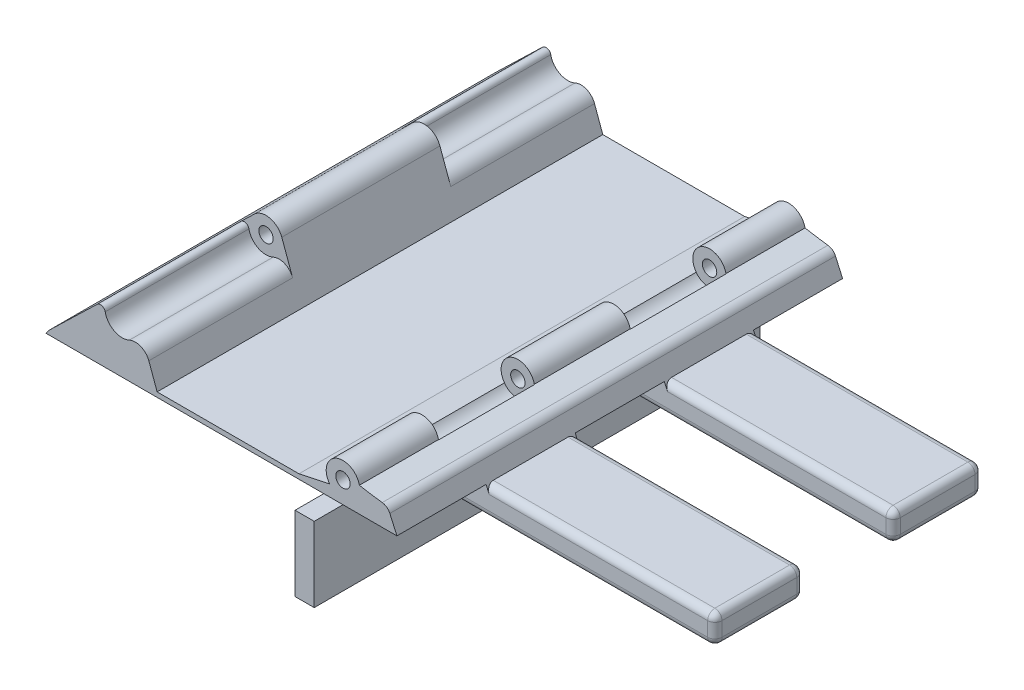
from build123d import *

# Parameters (mm, degrees)
SALIENTE_EXTRUIR2_DEPTH   = 46.49999999999997
CROQUIS3_R                = 1.5007742960379549
CROQUIS3_R_2              = 1.503322104684281
CORTAR_EXTRUIR1_DEPTH     = 46.49999999999997
CORTAR_EXTRUIR2_START     = 16.5
CORTAR_EXTRUIR2_OUTLINE_R = 1.500774296
CORTAR_EXTRUIR2_DEPTH     = 30
REDONDEO2_R               = 3
CORTAR_EXTRUIR3_START     = -46.5
CORTAR_EXTRUIR3_OUTLINE_R = 1.500774296
CORTAR_EXTRUIR3_DEPTH     = 30
REDONDEO3_R               = 3
CORTAR_EXTRUIR4_START     = 10
CORTAR_EXTRUIR4_OUTLINE_R = 1.503322105
CORTAR_EXTRUIR4_DEPTH     = 20
CORTAR_EXTRUIR5_START     = -30
CORTAR_EXTRUIR5_OUTLINE_R = 1.503322105
CORTAR_EXTRUIR5_DEPTH     = 20
REDONDEO4_R               = 1
CORTAR_EXTRUIR12_DEPTH    = 155.46083657878992
CROQUIS6_W                = 18.599999999999966
CROQUIS6_H                = 6.000000000000004
CORTAR_EXTRUIR13_DEPTH    = 133.823646460648
CROQUIS7_W                = 18.599999999999966
CROQUIS7_H                = 6.000000000000004
CORTAR_EXTRUIR14_DEPTH    = 133.823646460648
REDONDEO5_R               = 1.5
REDONDEO6_R               = 2


# Read off the part's stored shape, not the designer's step: Cortar-Extruir2, Cortar-Extruir3, Cortar-Extruir4, Cortar-Extruir5
with BuildPart() as part:
    # Croquis1 → Saliente-Extruir2 (new, symmetric)
    with BuildSketch(Plane.XY):
        with BuildLine():
            Line((-10.683677010448408, -0.13792021644576552), (-8.74048031278475, -4.500000000012256))
            Line((-8.74048031278475, -4.500000000012256), (39.00000000000001, -4.500000000012256))
            Line((39.00000000000001, -4.500000000012256), (39.00000000000001, -10.500000000012262))
            Line((39.00000000000001, -10.500000000012262), (-25.99999999999999, -10.500000000012262))
            Line((-25.99999999999999, -10.500000000012262), (-25.99999999999999, -26.10000000001226))
            Line((-25.99999999999999, -26.10000000001226), (-29.999999999999986, -26.100000000012262))
            Line((-29.999999999999986, -26.100000000012262), (-29.999999999999993, -10.500000000012264))
            Line((-29.999999999999993, -10.500000000012264), (-81.19999999999999, -10.500000000012271))
            ThreePointArc((-81.19999999999999, -10.500000000012271), (-82.6497474683058, -7.000000000012269), (-81.19999999999999, -3.5000000000122697))
            Line((-81.19999999999999, -3.5000000000122697), (-68.49110633124283, 8.777732226211745))
            ThreePointArc((-68.49110633124283, 8.777732226211745), (-65.27231144406849, 9.67090124633749), (-62.77037609438549, 7.457598074555828))
            Line((-62.77037609438549, 7.457598074555828), (-58.782136556190004, -3.5000000000122684))
            Line((-58.782136556190004, -3.5000000000122684), (-29.179236040573016, -3.500000000012267))
            Line((-29.179236040573016, -3.500000000012267), (-22.77115447929422, -2.1379202164457745))
            ThreePointArc((-22.77115447929422, -2.1379202164457745), (-21.470497358111732, 3.17610414183578), (-16.57695737694327, 0.729917256089285))
            ThreePointArc((-16.57695737694327, 0.729917256089285), (-13.63855195060632, 0.24007822050397465), (-10.683677010448408, -0.13792021644576552))
        make_face()
    extrude(amount=SALIENTE_EXTRUIR2_DEPTH, both=True)

    # Croquis3 → Cortar-Extruir1 (cut, symmetric)
    with BuildSketch(Plane.XY):
        with Locations((-66.05930026713617, 6.260527572915973)):
            Circle(CROQUIS3_R)
        with Locations((-19.999999999999996, 0)):
            Circle(CROQUIS3_R_2)
    extrude(amount=CORTAR_EXTRUIR1_DEPTH, both=True, mode=Mode.SUBTRACT)

    # Cortar-Extruir2 outline → Cortar-Extruir2 (cut)
    with BuildSketch(Plane.XY.offset(CORTAR_EXTRUIR2_START)):
        with BuildLine():
            Line((-68.491106331, 8.777732226), (-69.201699105, 8.091246996))
            ThreePointArc((-69.201699105, 8.091246996), (-66.848168988, 2.721235528), (-62.462991688, 6.61306636))
            Line((-62.462991688, 6.61306636), (-62.770376094, 7.457598075))
            ThreePointArc((-62.770376094, 7.457598075), (-65.272311444, 9.670901246), (-68.491106331, 8.777732226))
        make_face()
        with Locations((-66.059300267, 6.260527573)):
            Circle(CORTAR_EXTRUIR2_OUTLINE_R, mode=Mode.SUBTRACT)
    extrude(amount=CORTAR_EXTRUIR2_DEPTH, mode=Mode.SUBTRACT)

    # Redondeo2
    redondeo2_edges = [part.edges().sort_by_distance(p)[0] for p in [
        (-62.462991687999995, 6.613066360000001, 31.5),
    ]]
    fillet(redondeo2_edges, radius=REDONDEO2_R)

    # Cortar-Extruir3 outline → Cortar-Extruir3 (cut)
    with BuildSketch(Plane.XY.offset(CORTAR_EXTRUIR3_START)):
        with BuildLine():
            ThreePointArc((-69.164573514, 8.127113066), (-66.827048097, 2.685630168), (-62.508602445, 6.738380883))
            Line((-62.508602445, 6.738380883), (-62.770376094, 7.457598075))
            ThreePointArc((-62.770376094, 7.457598075), (-65.272311444, 9.670901246), (-68.491106331, 8.777732226))
            Line((-68.491106331, 8.777732226), (-69.164573514, 8.127113066))
        make_face()
        with Locations((-66.059300267, 6.260527573)):
            Circle(CORTAR_EXTRUIR3_OUTLINE_R, mode=Mode.SUBTRACT)
    extrude(amount=CORTAR_EXTRUIR3_DEPTH, mode=Mode.SUBTRACT)

    # Redondeo3
    redondeo3_edges = [part.edges().sort_by_distance(p)[0] for p in [
        (-62.508602444999994, 6.738380883, -31.5),
    ]]
    fillet(redondeo3_edges, radius=REDONDEO3_R)

    # Cortar-Extruir4 outline → Cortar-Extruir4 (cut)
    with BuildSketch(Plane.XY.offset(CORTAR_EXTRUIR4_START)):
        with BuildLine():
            Line((-22.771154479, -2.137920216), (-22.827271519, -2.149848262))
            ThreePointArc((-22.827271519, -2.149848262), (-18.523452571, -3.240720775), (-16.513304708, 0.718087877))
            ThreePointArc((-16.513304708, 0.718087877), (-16.545132262, 0.723996005), (-16.576957377, 0.729917256))
            ThreePointArc((-16.576957377, 0.729917256), (-21.470497358, 3.176104142), (-22.771154479, -2.137920216))
        make_face()
        with Locations((-20, 0)):
            Circle(CORTAR_EXTRUIR4_OUTLINE_R, mode=Mode.SUBTRACT)
    extrude(amount=CORTAR_EXTRUIR4_DEPTH, mode=Mode.SUBTRACT)

    # Cortar-Extruir5 outline → Cortar-Extruir5 (cut)
    with BuildSketch(Plane.XY.offset(CORTAR_EXTRUIR5_START)):
        with BuildLine():
            ThreePointArc((-22.813751372, -2.146974465), (-18.533466696, -3.203987987), (-16.523253553, 0.719933216))
            ThreePointArc((-16.523253553, 0.719933216), (-16.550106333, 0.724920565), (-16.576957377, 0.729917256))
            ThreePointArc((-16.576957377, 0.729917256), (-21.470497358, 3.176104142), (-22.771154479, -2.137920216))
            Line((-22.771154479, -2.137920216), (-22.813751372, -2.146974465))
        make_face()
        with Locations((-20, 0)):
            Circle(CORTAR_EXTRUIR5_OUTLINE_R, mode=Mode.SUBTRACT)
    extrude(amount=CORTAR_EXTRUIR5_DEPTH, mode=Mode.SUBTRACT)

    # Redondeo4
    redondeo4_edges = [part.edges().sort_by_distance(p)[0] for p in [
        (-69.20169910499999, 8.091246995999999, 31.5),
        (-69.164573514, 8.127113066, -31.5),
    ]]
    fillet(redondeo4_edges, radius=REDONDEO4_R)

    # Croquis3D6 → Cortar-Extruir12 (cut, through all)
    with BuildSketch(Plane(origin=(39.00000000000001, -10.500000000012262, -46.49999999999997), x_dir=(0, 0.30700277992275854, 0.9517086177605509), z_dir=(-1, 0, 0))):
        Polygon((0, 0), (17.701780290346246, -5.710251706563308), (19.543796969882806, 8.7e-16), (1.8420166795365527, 5.71025170656331), align=None)
    extrude(amount=CORTAR_EXTRUIR12_DEPTH, mode=Mode.SUBTRACT)

    # Croquis6 → Cortar-Extruir13 (cut, through all)
    with BuildSketch(Plane(origin=(39.00000000000001, 0, 0), x_dir=(0, 0, -1), z_dir=(1, 0, 0))):
        with Locations((-1.865e-14, -7.50000000001226)):
            Rectangle(CROQUIS6_W, CROQUIS6_H)
    extrude(amount=-CORTAR_EXTRUIR13_DEPTH, mode=Mode.SUBTRACT)

    # Croquis7 → Cortar-Extruir14 (cut, through all)
    with BuildSketch(Plane(origin=(39.00000000000001, 0, 0), x_dir=(0, 0, -1), z_dir=(1, 0, 0))):
        with Locations((-37.19999999999999, -7.50000000001226)):
            Rectangle(CROQUIS7_W, CROQUIS7_H)
    extrude(amount=-CORTAR_EXTRUIR14_DEPTH, mode=Mode.SUBTRACT)

    # Redondeo5
    redondeo5_edges = [part.edges().sort_by_distance(p)[0] for p in [
        (39.00000000000001, -7.500000000012258, -27.899999999999963),
        (15.12975984360763, -4.500000000012255, -27.899999999999963),
        (6.500000000000007, -10.50000000001226, -27.89999999999997),
        (39.00000000000001, -4.500000000012256, -18.599999999999966),
        (39.00000000000001, -10.500000000012262, -18.599999999999966),
        (6.500000000000007, -10.500000000012262, -9.299999999999965),
        (15.12975984360763, -4.500000000012258, -9.299999999999965),
        (6.500000000000007, -10.500000000012262, 9.300000000000002),
        (15.12975984360763, -4.500000000012258, 9.300000000000002),
        (39.00000000000001, -7.50000000001226, -9.299999999999965),
        (39.00000000000001, -7.50000000001226, 9.300000000000002),
        (39.00000000000001, -4.500000000012256, 18.600000000000005),
        (39.00000000000001, -10.500000000012262, 18.600000000000005),
        (15.12975984360763, -4.500000000012258, 27.900000000000006),
        (6.500000000000007, -10.500000000012262, 27.900000000000006),
        (39.00000000000001, -7.50000000001226, 27.900000000000006),
    ]]
    fillet(redondeo5_edges, radius=REDONDEO5_R)

    # Redondeo6
    redondeo6_edges = [part.edges().sort_by_distance(p)[0] for p in [
        (-10.683677010448406, -0.13792021644577176, 0),
    ]]
    fillet(redondeo6_edges, radius=REDONDEO6_R)


solid = part.part
